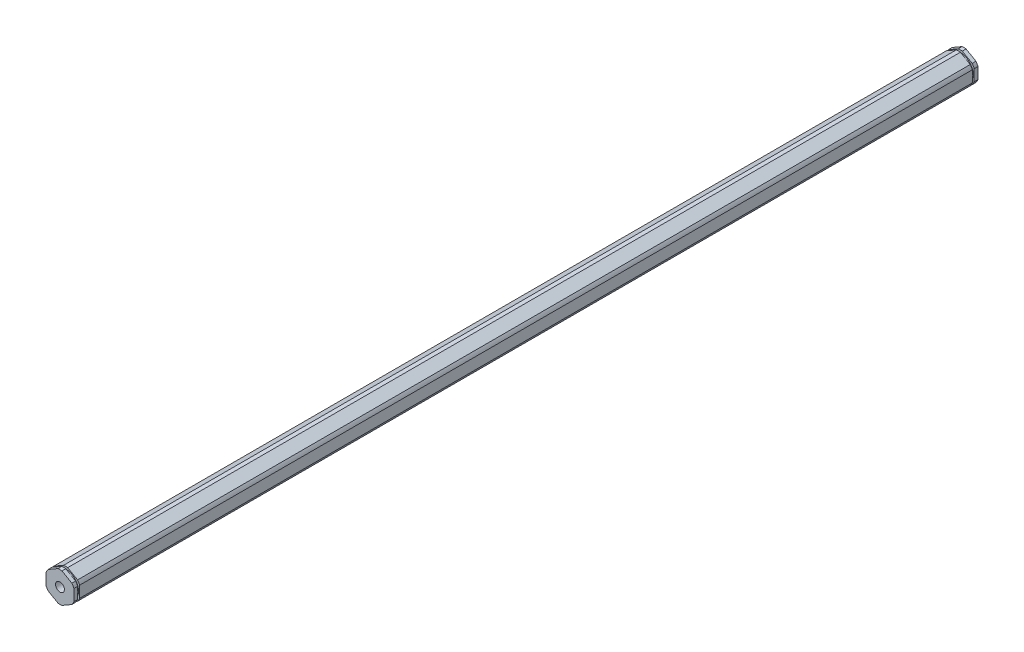
from build123d import *

# Parameters (mm, degrees)
BOSS_EXTRUDE1_DEPTH                  = 205.74635
F_10_32_TAPPED_HOLE1_D               = 4.0386
F_10_32_TAPPED_HOLE1_DEPTH           = 16.34744
F_10_32_TAPPED_HOLE1_TIP             = 1.213317848
F_10_32_TAPPED_HOLE1_ON_FACE_2_D     = 4.0386
F_10_32_TAPPED_HOLE1_ON_FACE_2_DEPTH = 16.34744
F_10_32_TAPPED_HOLE1_ON_FACE_2_TIP   = 1.213317848
SKETCH5_W                            = 0.889
SKETCH5_H                            = 1.0033


with BuildPart() as part:
    # Sketch1 → Boss-Extrude1 (new, symmetric)
    with BuildSketch(Plane.XY):
        with BuildLine():
            ThreePointArc((0.93173274, 6.79441227), (0, 6.858), (-0.93173274, 6.79441227))
            Line((-0.93173274, 6.79441227), (-5.41826726, 4.204110358))
            ThreePointArc((-5.41826726, 4.204110358), (-5.939202219, 3.429), (-6.35, 2.590301913))
            Line((-6.35, 2.590301913), (-6.35, -2.590301913))
            ThreePointArc((-6.35, -2.590301913), (-5.939202219, -3.429), (-5.41826726, -4.204110358))
            Line((-5.41826726, -4.204110358), (-0.93173274, -6.79441227))
            ThreePointArc((-0.93173274, -6.79441227), (0, -6.858), (0.93173274, -6.79441227))
            Line((0.93173274, -6.79441227), (5.41826726, -4.204110358))
            ThreePointArc((5.41826726, -4.204110358), (5.939202219, -3.429), (6.35, -2.590301913))
            Line((6.35, -2.590301913), (6.35, 2.590301913))
            ThreePointArc((6.35, 2.590301913), (5.939202219, 3.429), (5.41826726, 4.204110358))
            Line((5.41826726, 4.204110358), (0.93173274, 6.79441227))
        make_face()
    extrude(amount=BOSS_EXTRUDE1_DEPTH, both=True)

    # #10-32 Tapped Hole1
    with Locations(Plane.XY.offset(205.74635)):
        with Locations((0, 0)):
            Hole(F_10_32_TAPPED_HOLE1_D / 2, depth=F_10_32_TAPPED_HOLE1_DEPTH)
            with Locations((0, 0, -(F_10_32_TAPPED_HOLE1_DEPTH + F_10_32_TAPPED_HOLE1_TIP / 2))):  # 118° drill point
                Cone(0, F_10_32_TAPPED_HOLE1_D / 2, F_10_32_TAPPED_HOLE1_TIP, mode=Mode.SUBTRACT)

    # #10-32 Tapped Hole1 on face 2
    with Locations(Plane(origin=(0, 0, -205.74635), x_dir=(-1, 0, 0), z_dir=(0, 0, -1))):
        with Locations((0, 0)):
            Hole(F_10_32_TAPPED_HOLE1_ON_FACE_2_D / 2, depth=F_10_32_TAPPED_HOLE1_ON_FACE_2_DEPTH)
            with Locations((0, 0, -(F_10_32_TAPPED_HOLE1_ON_FACE_2_DEPTH + F_10_32_TAPPED_HOLE1_ON_FACE_2_TIP / 2))):  # 118° drill point
                Cone(0, F_10_32_TAPPED_HOLE1_ON_FACE_2_D / 2, F_10_32_TAPPED_HOLE1_ON_FACE_2_TIP, mode=Mode.SUBTRACT)

    # Sketch5 → Cut-Revolve1 (revolve, cut)
    with BuildSketch(Plane(origin=(0, 0, 0), x_dir=(0, 0, -1), z_dir=(1, 0, 0))):
        with Locations((-203.58735, 6.35635)):
            Rectangle(SKETCH5_W, SKETCH5_H)
    cut_revolve1 = revolve(axis=Axis((0, 0, 165.047176272), (0, 0, -1)), mode=Mode.SUBTRACT)

    # Mirror1: Cut-Revolve1 across plane
    add(cut_revolve1.mirror(Plane.XY), mode=Mode.SUBTRACT)


solid = part.part
